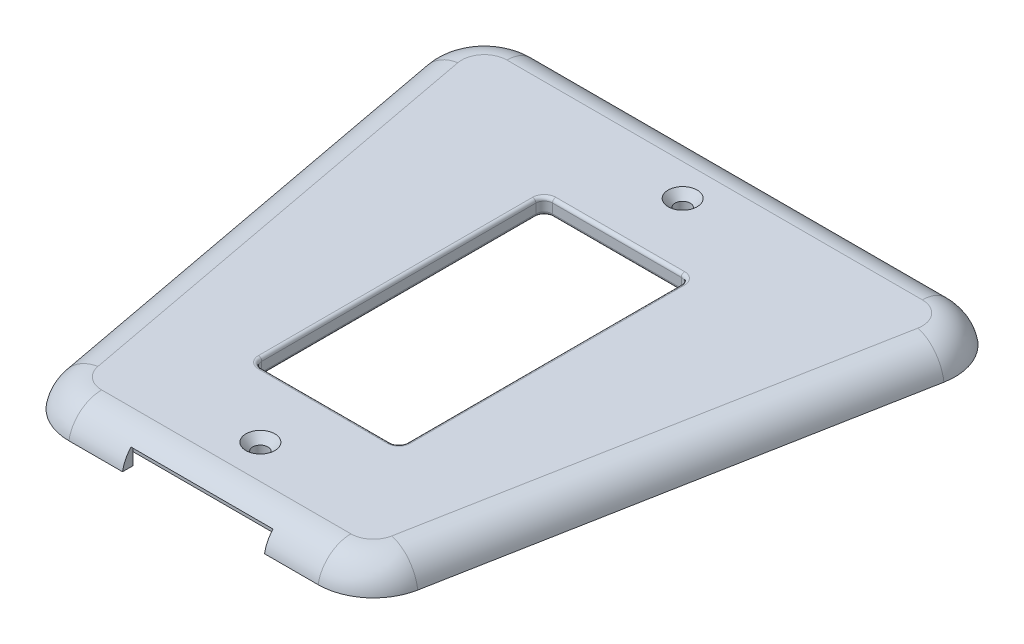
from build123d import *

# Parameters (mm, degrees)
BOSS_EXTRUDE1_DEPTH                               = 6.35
SHELL1_T                                          = -2.413
FILLET1_R                                         = 7.62
SKETCH4_R                                         = 4.445
BOSS_EXTRUDE2_DEPTH                               = 1.27
CSK_FOR_3_FLAT_HEAD_MACHINE_SCREW_100_D           = 3.5052
CSK_FOR_3_FLAT_HEAD_MACHINE_SCREW_100_CSINK_D     = 6.6548
CSK_FOR_3_FLAT_HEAD_MACHINE_SCREW_100_CSINK_ANGLE = 82
CUT_EXTRUDE3_DEPTH                                = 5.588
SKETCH9_W                                         = 32.5628
SKETCH9_H                                         = 2.413
CUT_EXTRUDE4_DEPTH                                = 3.97002
BOSS_EXTRUDE3_DEPTH                               = 3.937
BOSS_EXTRUDE4_DEPTH                               = 1.27
CUT_EXTRUDE5_DEPTH                                = 162.42381732
FILLET2_R                                         = 0.762


with BuildPart() as part:
    # Sketch1 → Boss-Extrude1 (new body)
    with BuildSketch(Plane(origin=(0, 0, 0), x_dir=(1, 0, 0), z_dir=(0, 1, 0))):
        with BuildLine():
            Line((-20.992412926, 111.959535605), (-1.942412926, 10.359535605))
            ThreePointArc((-1.942412926, 10.359535605), (2.429388717, 2.927234327), (10.540063848, 0))
            Line((10.540063848, 0), (67.690063848, 0))
            ThreePointArc((67.690063848, 0), (75.80073898, 2.927234327), (80.172540622, 10.359535605))
            Line((80.172540622, 10.359535605), (99.222540622, 111.959535605))
            ThreePointArc((99.222540622, 111.959535605), (96.512829522, 122.410675132), (86.740063848, 127))
            Line((86.740063848, 127), (-8.509936152, 127))
            ThreePointArc((-8.509936152, 127), (-18.282701825, 122.410675132), (-20.992412926, 111.959535605))
        make_face()
    extrude(amount=BOSS_EXTRUDE1_DEPTH)

    # Shell1
    shell1_openings = [part.faces().sort_by_distance(p)[0] for p in [
        (39.115063848, 0, -68.214548016),
    ]]
    offset(amount=SHELL1_T, openings=shell1_openings, kind=Kind.INTERSECTION)

    # Fillet1
    # the kernel refuses this fillet: 7.62 mm, written as the material it takes off along each edge
    with BuildSketch(Plane(origin=(67.690063848, 6.35, -12.7), x_dir=(0, 0, 1), z_dir=(-1, 0, 0))) as fillet1_piece_1:
        with BuildLine():
            CenterArc((5.186578675, -7.62), FILLET1_R, 9.594068227, 80.405931773)
            Line((5.186578675, 0), (5.186578675, 0.1524))
            Line((5.186578675, 0.1524), (12.7, 0.1524))
            Line((12.7, 0.1524), (12.8524, 0))
            ThreePointArc((12.8524, 0), (12.8524, -3.175), (12.850268426, -6.3246))
            Line((12.850268426, -6.3246), (12.7, -6.35))
        make_face()
    revolve(axis=Axis((67.690063848, 6.35, -12.7), (0, 1, 0)), revolution_arc=79.380344724, mode=Mode.SUBTRACT)
    with BuildSketch(Plane(origin=(10.540063848, 6.35, 0), x_dir=(0, -1, 0), z_dir=(1, 0, 0))) as fillet1_piece_2:
        with BuildLine():
            CenterArc((7.62, 7.513421325), FILLET1_R, 180, 80.405931773)
            Line((0, 7.513421325), (-0.1524, 7.513421325))
            Line((-0.1524, 7.513421325), (-0.1524, 0))
            Line((-0.1524, 0), (0, -0.1524))
            ThreePointArc((0, -0.1524), (3.175, -0.1524), (6.3246, -0.150268426))
            Line((6.3246, -0.150268426), (6.35, 0))
        make_face()
    extrude(amount=57.15, mode=Mode.SUBTRACT)
    with BuildSketch(Plane(origin=(10.540063848, 6.35, -12.7), x_dir=(-0.9828721869343217, 0, 0.18428853505018647), z_dir=(-0.18428853505018647, 0, -0.9828721869343217))) as fillet1_piece_3:
        with BuildLine():
            CenterArc((5.186578675, -7.62), FILLET1_R, 9.594068227, 80.405931773)
            Line((5.186578675, 0), (5.186578675, 0.1524))
            Line((5.186578675, 0.1524), (12.7, 0.1524))
            Line((12.7, 0.1524), (12.8524, 0))
            ThreePointArc((12.8524, 0), (12.8524, -3.175), (12.850268426, -6.3246))
            Line((12.850268426, -6.3246), (12.7, -6.35))
        make_face()
    revolve(axis=Axis((10.540063848, 6.35, -12.7), (0, 1, 0)), revolution_arc=79.380344724, mode=Mode.SUBTRACT)
    with BuildSketch(Plane(origin=(-20.992412926, 6.35, -111.959535605), x_dir=(0, -1, 0), z_dir=(0.18428853505018555, 0, 0.982872186934322)), Plane(origin=(80.172540622, 6.35, -10.359535605), x_dir=(0, -1, 0), z_dir=(0.18428853505018533, 0, -0.982872186934322))) as fillet1_piece_4:
        with BuildLine():
            CenterArc((7.62, 7.513421325), FILLET1_R, 180, 80.405931773)
            Line((0, 7.513421325), (-0.1524, 7.513421325))
            Line((-0.1524, 7.513421325), (-0.1524, 0))
            Line((-0.1524, 0), (0, -0.1524))
            ThreePointArc((0, -0.1524), (3.175, -0.1524), (6.3246, -0.150268426))
            Line((6.3246, -0.150268426), (6.35, 0))
        make_face()
    extrude(amount=103.370510785, mode=Mode.SUBTRACT)
    with BuildSketch(Plane(origin=(-8.509936152, 6.35, -114.3), x_dir=(0, 0, -1), z_dir=(1, 0, 0))) as fillet1_piece_5:
        with BuildLine():
            CenterArc((5.186578675, -7.62), FILLET1_R, 9.594068227, 80.405931773)
            Line((5.186578675, 0), (5.186578675, 0.1524))
            Line((5.186578675, 0.1524), (12.7, 0.1524))
            Line((12.7, 0.1524), (12.8524, 0))
            ThreePointArc((12.8524, 0), (12.8524, -3.175), (12.850268426, -6.3246))
            Line((12.850268426, -6.3246), (12.7, -6.35))
        make_face()
    revolve(axis=Axis((-8.509936152, 6.35, -114.3), (0, 1, 0)), revolution_arc=100.619655276, mode=Mode.SUBTRACT)
    with BuildSketch(Plane(origin=(86.740063848, 6.35, -127), x_dir=(0, -1, 0), z_dir=(-1, 0, 0))) as fillet1_piece_6:
        with BuildLine():
            CenterArc((7.62, 7.513421325), FILLET1_R, 180, 80.405931773)
            Line((0, 7.513421325), (-0.1524, 7.513421325))
            Line((-0.1524, 7.513421325), (-0.1524, 0))
            Line((-0.1524, 0), (0, -0.1524))
            ThreePointArc((0, -0.1524), (3.175, -0.1524), (6.3246, -0.150268426))
            Line((6.3246, -0.150268426), (6.35, 0))
        make_face()
    extrude(amount=95.25, mode=Mode.SUBTRACT)
    with BuildSketch(Plane(origin=(86.740063848, 6.35, -114.3), x_dir=(0.9828721869343223, 0, 0.18428853505018347), z_dir=(-0.18428853505018347, 0, 0.9828721869343223))) as fillet1_piece_7:
        with BuildLine():
            CenterArc((5.186578675, -7.62), FILLET1_R, 9.594068227, 80.405931773)
            Line((5.186578675, 0), (5.186578675, 0.1524))
            Line((5.186578675, 0.1524), (12.7, 0.1524))
            Line((12.7, 0.1524), (12.8524, 0))
            ThreePointArc((12.8524, 0), (12.8524, -3.175), (12.850268426, -6.3246))
            Line((12.850268426, -6.3246), (12.7, -6.35))
        make_face()
    revolve(axis=Axis((86.740063848, 6.35, -114.3), (0, 1, 0)), revolution_arc=100.619655276, mode=Mode.SUBTRACT)

    # Sketch4 → Boss-Extrude2 (add)
    with BuildSketch(Plane.XZ.offset(-3.937)):
        with Locations(Location((39.115063848, -112.152772571, 0), (0, 0, 270))):
            Circle(SKETCH4_R)
        with Locations(Location((39.115063848, -15.327972571, 0), (0, 0, 270))):
            Circle(SKETCH4_R)
    extrude(amount=BOSS_EXTRUDE2_DEPTH)

    # CSK for #3 Flat Head Machine Screw (100)1 (through all)
    with Locations(Plane(origin=(39.115063848, 6.35, -112.152772571), x_dir=(0, 0, 1), z_dir=(0, 1, 0))):
        with Locations((0, 0), (96.8248, 0)):
            CounterSinkHole(CSK_FOR_3_FLAT_HEAD_MACHINE_SCREW_100_D / 2, CSK_FOR_3_FLAT_HEAD_MACHINE_SCREW_100_CSINK_D / 2, counter_sink_angle=CSK_FOR_3_FLAT_HEAD_MACHINE_SCREW_100_CSINK_ANGLE)

    # Sketch8 → Cut-Extrude3 (cut)
    with BuildSketch(Plane(origin=(0, 6.35, 0), x_dir=(1, 0, 0), z_dir=(0, 1, 0))):
        with BuildLine():
            Line((24.351313848, 97.077872571), (53.878813848, 97.077872571))
            ThreePointArc((53.878813848, 97.077872571), (55.225852266, 96.519910989), (55.783813848, 95.172872571))
            Line((55.783813848, 95.172872571), (55.783813848, 32.307872571))
            ThreePointArc((55.783813848, 32.307872571), (55.225852266, 30.960834153), (53.878813848, 30.402872571))
            Line((53.878813848, 30.402872571), (24.351313848, 30.402872571))
            ThreePointArc((24.351313848, 30.402872571), (23.00427543, 30.960834153), (22.446313848, 32.307872571))
            Line((22.446313848, 32.307872571), (22.446313848, 95.172872571))
            ThreePointArc((22.446313848, 95.172872571), (23.00427543, 96.519910989), (24.351313848, 97.077872571))
        make_face()
    extrude(amount=-CUT_EXTRUDE3_DEPTH, mode=Mode.SUBTRACT)

    # Sketch9 → Cut-Extrude4 (cut)
    with BuildSketch(Plane.XZ.offset(-3.937)):
        with Locations((39.115063848, -1.2065)):
            Rectangle(SKETCH9_W, SKETCH9_H)
    extrude(amount=CUT_EXTRUDE4_DEPTH, mode=Mode.SUBTRACT)

    # Sketch9<3> → Boss-Extrude3 (add)
    with BuildSketch(Plane.XZ.offset(-3.937)):
        Polygon((15.620063848, -2.413), (13.080063848, -2.413), (13.080063848, -7.731125), (39.115063848, -7.731125), (39.115063848, -5.191125), (15.620063848, -5.191125), align=None)
        Polygon((39.115063848, -5.191125), (39.115063848, -7.731125), (65.150063848, -7.731125), (65.150063848, -2.413), (62.610063848, -2.413), (62.610063848, -5.191125), align=None)
    extrude(amount=BOSS_EXTRUDE3_DEPTH)

    # Sketch10 → Boss-Extrude4 (add)
    with BuildSketch(Plane.XZ.offset(-3.937)):
        with BuildLine():
            Line((57.371313848, -95.172872571), (57.371313848, -32.307872571))
            ThreePointArc((57.371313848, -32.307872571), (56.348384281, -29.838302138), (53.878813848, -28.815372571))
            Line((53.878813848, -28.815372571), (24.351313848, -28.815372571))
            ThreePointArc((24.351313848, -28.815372571), (21.881743415, -29.838302138), (20.858813848, -32.307872571))
            Line((20.858813848, -32.307872571), (20.858813848, -95.172872571))
            ThreePointArc((20.858813848, -95.172872571), (21.881743415, -97.642443004), (24.351313848, -98.665372571))
            Line((24.351313848, -98.665372571), (53.878813848, -98.665372571))
            ThreePointArc((53.878813848, -98.665372571), (56.348384281, -97.642443004), (57.371313848, -95.172872571))
        make_face()
    extrude(amount=BOSS_EXTRUDE4_DEPTH)

    # Sketch8<3> → Cut-Extrude5 (cut, through all)
    with BuildSketch(Plane(origin=(0, 6.35, 0), x_dir=(1, 0, 0), z_dir=(0, 1, 0))):
        with BuildLine():
            Line((24.351313848, 97.077872571), (53.878813848, 97.077872571))
            ThreePointArc((53.878813848, 97.077872571), (55.225852266, 96.519910989), (55.783813848, 95.172872571))
            Line((55.783813848, 95.172872571), (55.783813848, 32.307872571))
            ThreePointArc((55.783813848, 32.307872571), (55.225852266, 30.960834153), (53.878813848, 30.402872571))
            Line((53.878813848, 30.402872571), (24.351313848, 30.402872571))
            ThreePointArc((24.351313848, 30.402872571), (23.00427543, 30.960834153), (22.446313848, 32.307872571))
            Line((22.446313848, 32.307872571), (22.446313848, 95.172872571))
            ThreePointArc((22.446313848, 95.172872571), (23.00427543, 96.519910989), (24.351313848, 97.077872571))
        make_face()
    extrude(amount=-CUT_EXTRUDE5_DEPTH, mode=Mode.SUBTRACT)

    # Fillet2
    fillet2_edges = [part.edges().sort_by_distance(p)[0] for p in [
        (56.348384281, 2.667, -97.642443004),
        (57.371313848, 2.667, -63.740372571),
        (56.348384281, 2.667, -29.838302138),
        (39.115063848, 2.667, -28.815372571),
        (21.881743415, 2.667, -29.838302138),
        (20.858813848, 2.667, -63.740372571),
        (21.881743415, 2.667, -97.642443004),
        (39.115063848, 2.667, -98.665372571),
        (39.115063848, 2.667, -30.402872571),
        (55.225852266, 2.667, -30.960834153),
        (55.783813848, 2.667, -63.740372571),
        (55.225852266, 2.667, -96.519910989),
        (39.115063848, 2.667, -97.077872571),
        (23.00427543, 2.667, -96.519910989),
        (22.446313848, 2.667, -63.740372571),
        (23.00427543, 2.667, -30.960834153),
        (39.115063848, 2.667, -107.707772571),
        (39.115063848, 2.667, -10.882972571),
        (23.00427543, 6.35, -30.960834153),
        (39.115063848, 6.35, -30.402872571),
        (55.225852266, 6.35, -30.960834153),
        (55.783813848, 6.35, -63.740372571),
        (55.225852266, 6.35, -96.519910989),
        (39.115063848, 6.35, -97.077872571),
        (23.00427543, 6.35, -96.519910989),
        (22.446313848, 6.35, -63.740372571),
    ]]
    fillet(fillet2_edges, radius=FILLET2_R)


solid = part.part
